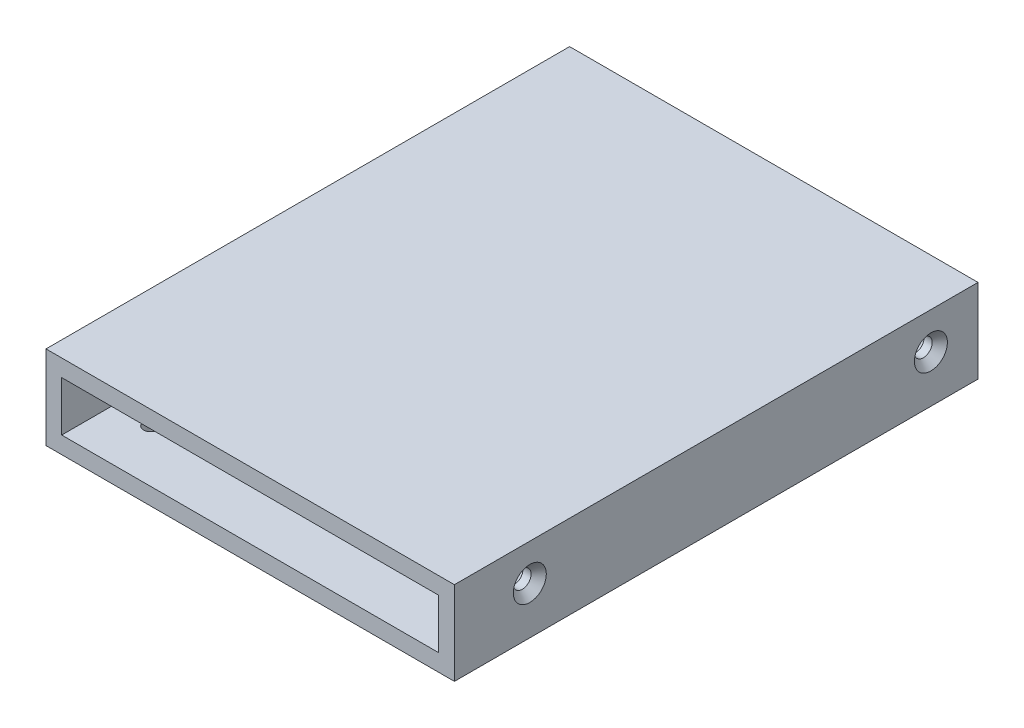
from build123d import *

# Parameters (mm, degrees)
MAIN_SKETCH_W                                  = 78
MAIN_SKETCH_H                                  = 16
MAIN_SKETCH_W_2                                = 72
MAIN_SKETCH_H_2                                = 9.5
MAIN_EXTRUSION_DEPTH                           = 100
FRAISAGE_POUR_VIS_T_TE_FRAIS_E_M31_D           = 3.4
FRAISAGE_POUR_VIS_T_TE_FRAIS_E_M31_CSINK_D     = 6.3
FRAISAGE_POUR_VIS_T_TE_FRAIS_E_M31_CSINK_ANGLE = 90
R_P_TITION_LIN_AIRE1_COUNT                     = 2
R_P_TITION_LIN_AIRE1_PITCH                     = 76.6
FRAISAGE_POUR_VIS_T_TE_FRAIS_E_M32_D           = 3.4
FRAISAGE_POUR_VIS_T_TE_FRAIS_E_M32_CSINK_D     = 6.3
FRAISAGE_POUR_VIS_T_TE_FRAIS_E_M32_CSINK_ANGLE = 90
R_P_TITION_LIN_AIRE3_COUNT                     = 2
R_P_TITION_LIN_AIRE3_PITCH                     = 76.5
FRAISAGE_POUR_VIS_T_TE_FRAIS_E_M33_D           = 3.4
FRAISAGE_POUR_VIS_T_TE_FRAIS_E_M33_CSINK_D     = 6.3
FRAISAGE_POUR_VIS_T_TE_FRAIS_E_M33_CSINK_ANGLE = 90
SUPPORT_FIX_HOLE_REACH                         = 129.828
SUPPORT_FIX_SKETCH_R                           = 1.35


with BuildPart() as part:
    # Main-Sketch → Main-Extrusion (new body)
    with BuildSketch(Plane.XY):
        with Locations((39, 8)):
            Rectangle(MAIN_SKETCH_W, MAIN_SKETCH_H)
        with Locations((39, 8)):
            Rectangle(MAIN_SKETCH_W_2, MAIN_SKETCH_H_2, mode=Mode.SUBTRACT)
    extrude(amount=MAIN_EXTRUSION_DEPTH)

    # Fraisage pour vis à tête fraisée M31 (through all)
    with Locations(Plane.ZY):
        with Locations((9, 9)):
            fraisage_pour_vis_t_te_frais_e_m31 = CounterSinkHole(FRAISAGE_POUR_VIS_T_TE_FRAIS_E_M31_D / 2, FRAISAGE_POUR_VIS_T_TE_FRAIS_E_M31_CSINK_D / 2, counter_sink_angle=FRAISAGE_POUR_VIS_T_TE_FRAIS_E_M31_CSINK_ANGLE)

    # Répétition linéaire1: Fraisage pour vis à tête fraisée M31 ×2
    with Locations(*[(0, 0, i * R_P_TITION_LIN_AIRE1_PITCH) for i in range(1, R_P_TITION_LIN_AIRE1_COUNT)]):
        add(fraisage_pour_vis_t_te_frais_e_m31, mode=Mode.SUBTRACT)

    # Fraisage pour vis à tête fraisée M32 (through all)
    with Locations(Plane(origin=(78, 0, 0), x_dir=(0, 0, -1), z_dir=(1, 0, 0))):
        with Locations((-85.6, 9)):
            fraisage_pour_vis_t_te_frais_e_m32 = CounterSinkHole(FRAISAGE_POUR_VIS_T_TE_FRAIS_E_M32_D / 2, FRAISAGE_POUR_VIS_T_TE_FRAIS_E_M32_CSINK_D / 2, counter_sink_angle=FRAISAGE_POUR_VIS_T_TE_FRAIS_E_M32_CSINK_ANGLE)

    # Répétition linéaire3: Fraisage pour vis à tête fraisée M32 ×2
    with Locations(*[(i * R_P_TITION_LIN_AIRE3_PITCH, 0, 0) for i in range(1, R_P_TITION_LIN_AIRE3_COUNT)]):
        add(fraisage_pour_vis_t_te_frais_e_m32, mode=Mode.SUBTRACT)

    # Fraisage pour vis à tête fraisée M33 (through all)
    with Locations(Plane(origin=(78, 0, 0), x_dir=(0, 0, -1), z_dir=(1, 0, 0))):
        with Locations((-9, 9)):
            CounterSinkHole(FRAISAGE_POUR_VIS_T_TE_FRAIS_E_M33_D / 2, FRAISAGE_POUR_VIS_T_TE_FRAIS_E_M33_CSINK_D / 2, counter_sink_angle=FRAISAGE_POUR_VIS_T_TE_FRAIS_E_M33_CSINK_ANGLE)

    # Support-Fix-Sketch → Support-Fix-Hole (cut, up to next)
    with BuildSketch(Plane.XZ, mode=Mode.PRIVATE) as support_fix_hole_sk1:
        with Locations((68, 90)):
            Circle(SUPPORT_FIX_SKETCH_R)
    support_fix_hole_tool1 = extrude(support_fix_hole_sk1.sketch, amount=-SUPPORT_FIX_HOLE_REACH, mode=Mode.PRIVATE) & part.part
    # Support-Fix-Sketch → Support-Fix-Hole (cut, up to next)
    with BuildSketch(Plane.XZ, mode=Mode.PRIVATE) as support_fix_hole_sk2:
        with Locations((68, 10)):
            Circle(SUPPORT_FIX_SKETCH_R)
    support_fix_hole_tool2 = extrude(support_fix_hole_sk2.sketch, amount=-SUPPORT_FIX_HOLE_REACH, mode=Mode.PRIVATE) & part.part
    # Support-Fix-Sketch → Support-Fix-Hole (cut, up to next)
    with BuildSketch(Plane.XZ, mode=Mode.PRIVATE) as support_fix_hole_sk3:
        with Locations((10, 10)):
            Circle(SUPPORT_FIX_SKETCH_R)
    support_fix_hole_tool3 = extrude(support_fix_hole_sk3.sketch, amount=-SUPPORT_FIX_HOLE_REACH, mode=Mode.PRIVATE) & part.part
    # Support-Fix-Sketch → Support-Fix-Hole (cut, up to next)
    with BuildSketch(Plane.XZ, mode=Mode.PRIVATE) as support_fix_hole_sk4:
        with Locations((10, 90)):
            Circle(SUPPORT_FIX_SKETCH_R)
    support_fix_hole_tool4 = extrude(support_fix_hole_sk4.sketch, amount=-SUPPORT_FIX_HOLE_REACH, mode=Mode.PRIVATE) & part.part
    add(support_fix_hole_tool1.solids().sort_by_distance((68, 0, 90))[0], mode=Mode.SUBTRACT)
    add(support_fix_hole_tool2.solids().sort_by_distance((68, 0, 10))[0], mode=Mode.SUBTRACT)
    add(support_fix_hole_tool3.solids().sort_by_distance((10, 0, 10))[0], mode=Mode.SUBTRACT)
    add(support_fix_hole_tool4.solids().sort_by_distance((10, 0, 90))[0], mode=Mode.SUBTRACT)


solid = part.part
